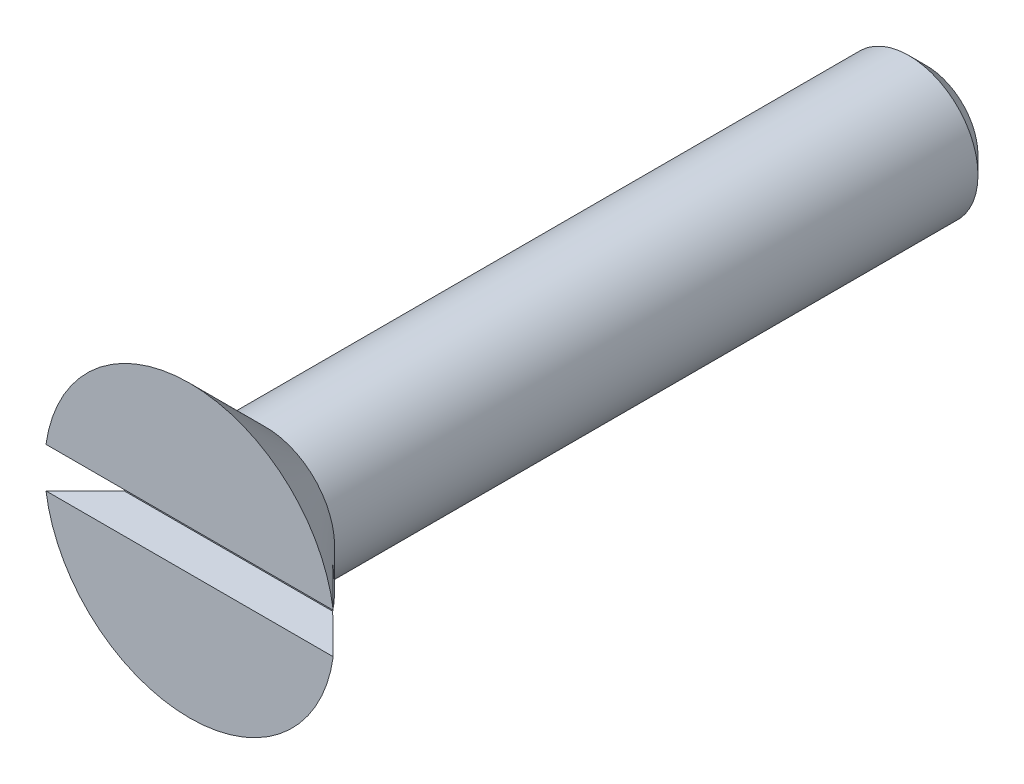
from build123d import *

# Parameters (mm, degrees)
SKETCH9_W          = 6.3
SKETCH9_H          = 0.875
CUT_EXTRUDE1_DEPTH = 0.85


with BuildPart() as part:
    # Sketch3 → Revolve1 (revolve)
    with BuildSketch(Plane(origin=(0, 0, 0), x_dir=(0, 0, -1), z_dir=(1, 0, 0))):
        Polygon((-1.7, 3.15), (-0.05, 1.5), (13.925, 1.5), (14.3, 1.125), (14.3, 0), (-1.7, 0), align=None)
    revolve(axis=Axis((0, 0, 1.7), (0, 0, -1)))

    # Sketch9 → Cut-Extrude1 (cut)
    with BuildSketch(Plane.XY.offset(1.7)):
        Rectangle(SKETCH9_W, SKETCH9_H)
    extrude(amount=-CUT_EXTRUDE1_DEPTH, mode=Mode.SUBTRACT)


solid = part.part
